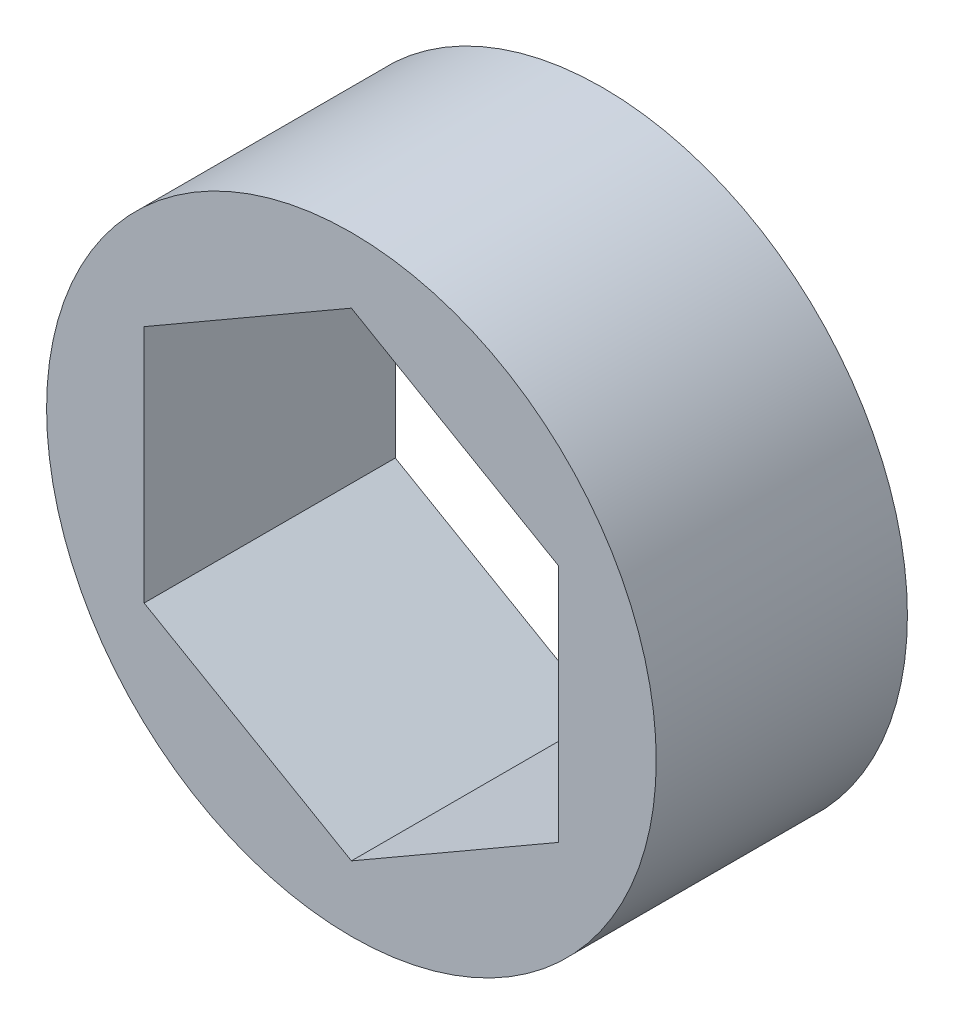
from build123d import *

# Parameters (mm, degrees)
SKETCH1_R           = 9.525
BOSS_EXTRUDE1_DEPTH = 3.9243


with BuildPart() as part:
    # Sketch1 → Boss-Extrude1 (new, symmetric)
    with BuildSketch(Plane.XY):
        Circle(SKETCH1_R)
        Polygon((0, 7.478995387), (-6.477, 3.739497694), (-6.477, -3.739497694), (0, -7.478995387), (6.477, -3.739497694), (6.477, 3.739497694), align=None, mode=Mode.SUBTRACT)
    extrude(amount=BOSS_EXTRUDE1_DEPTH, both=True)


solid = part.part
